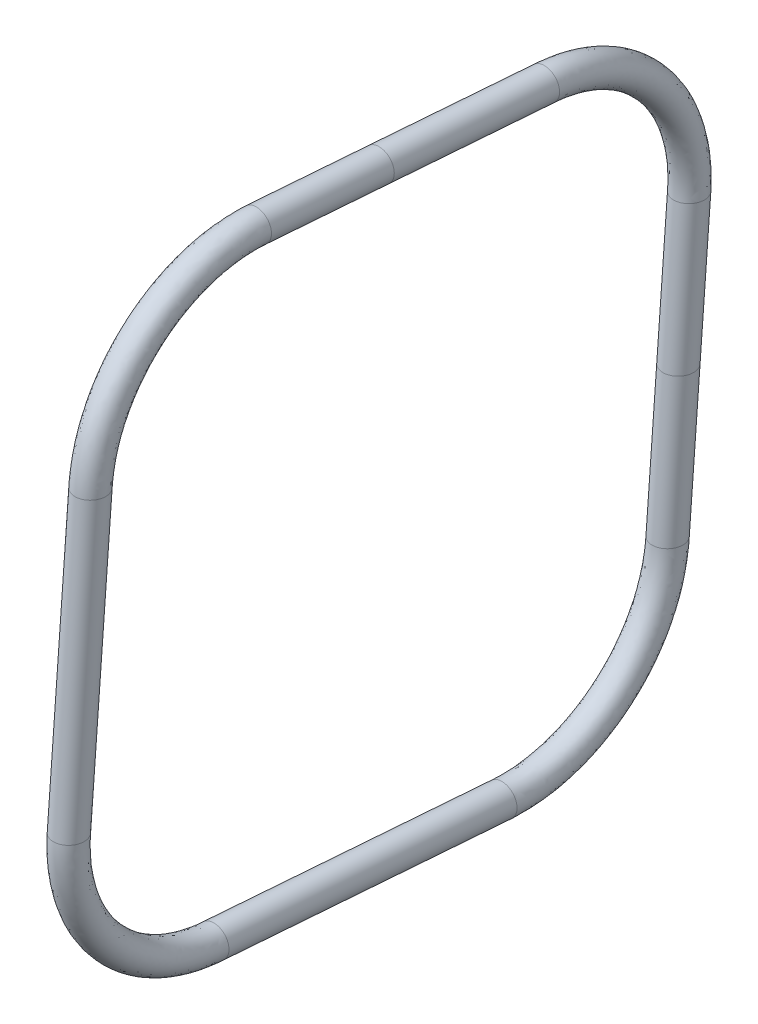
from build123d import *

# Parameters (mm, degrees)
SKETCH3_RX = 1.7653
SKETCH3_RY = 1.7399


with BuildPart() as part:
    # Sweep3: sweep along a path in Sketch4
    with BuildLine(Plane(origin=(0, 0, 0), x_dir=(0, 0, -1), z_dir=(1, 0, 0))) as sweep3_path:
        Line((-33.647493483, -14.019320476), (-31.184947753, 18.873107797))
        ThreePointArc((-31.184947753, 18.873107797), (-25.662009578, 29.815418452), (-14.019320476, 33.647493483))
        Line((-14.019320476, 33.647493483), (18.873107797, 31.184947753))
        ThreePointArc((18.873107797, 31.184947753), (29.815418452, 25.662009578), (33.647493483, 14.019320476))
        Line((33.647493483, 14.019320476), (32.416220618, -2.42689366))
        Line((32.416220618, -2.42689366), (31.184947753, -18.873107797))
        ThreePointArc((31.184947753, -18.873107797), (25.662009578, -29.815418452), (14.019320476, -33.647493483))
        Line((14.019320476, -33.647493483), (-18.873107797, -31.184947753))
        ThreePointArc((-18.873107797, -31.184947753), (-29.815418452, -25.662009578), (-33.647493483, -14.019320476))
    # Sketch3 → Sweep3 (sweep)
    with BuildSketch(Plane.XY):
        with Locations(Location((0, 34.363214003), (0, 0, -90))):
            Ellipse(SKETCH3_RX, SKETCH3_RY)
    sweep(path=sweep3_path.line)


solid = part.part
